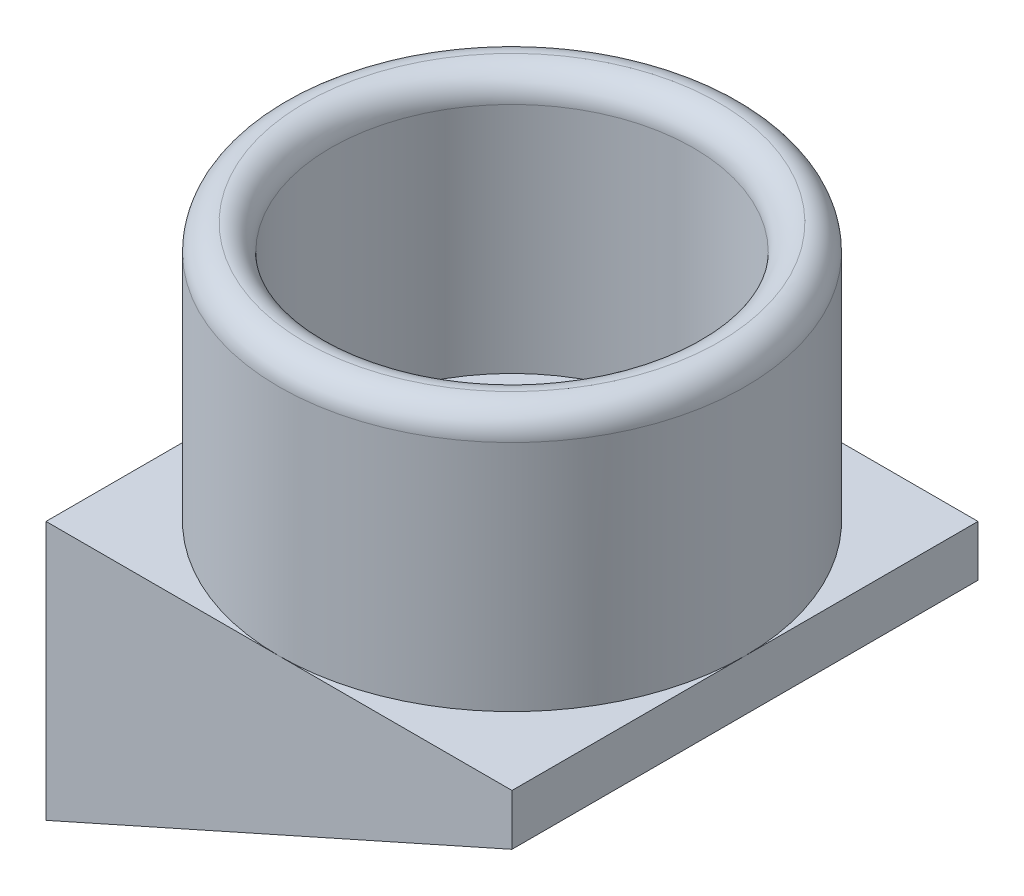
from build123d import *

# Parameters (mm, degrees)
SKETCH1_R           = 9
SKETCH1_R_2         = 7
BOSS_EXTRUDE1_DEPTH = 10
FILLET1_R           = 1
SKETCH2_W           = 18
SKETCH2_H           = 18
BOSS_EXTRUDE2_DEPTH = 10
CUT_EXTRUDE1_DEPTH  = 23.472205054


with BuildPart() as part:
    # Sketch1 → Boss-Extrude1 (new body)
    with BuildSketch(Plane(origin=(0, 0, 0), x_dir=(1, 0, 0), z_dir=(0, 1, 0))):
        with Locations(Location((0, 0, 0), (0, 0, 270))):
            Circle(SKETCH1_R)
        with Locations(Location((0, 0, 0), (0, 0, 270))):
            Circle(SKETCH1_R_2, mode=Mode.SUBTRACT)
    extrude(amount=BOSS_EXTRUDE1_DEPTH)

    # Fillet1
    fillet1_edges = [part.edges().sort_by_distance(p)[0] for p in [
        (0, 10, -9),
        (0, 10, -7),
    ]]
    fillet(fillet1_edges, radius=FILLET1_R - 0.0001)  # a hair under: the kernel refuses the full size

    # Sketch2 → Boss-Extrude2 (add)
    with BuildSketch(Plane.XZ):
        Rectangle(SKETCH2_W, SKETCH2_H)
    extrude(amount=BOSS_EXTRUDE2_DEPTH)

    # Sketch4 → Cut-Extrude1 (cut, through all)
    with BuildSketch(Plane.XY.offset(9)):
        Polygon((-9, -10), (9, -10), (9, -1.969771915), align=None)
    extrude(amount=-CUT_EXTRUDE1_DEPTH, mode=Mode.SUBTRACT)


solid = part.part
